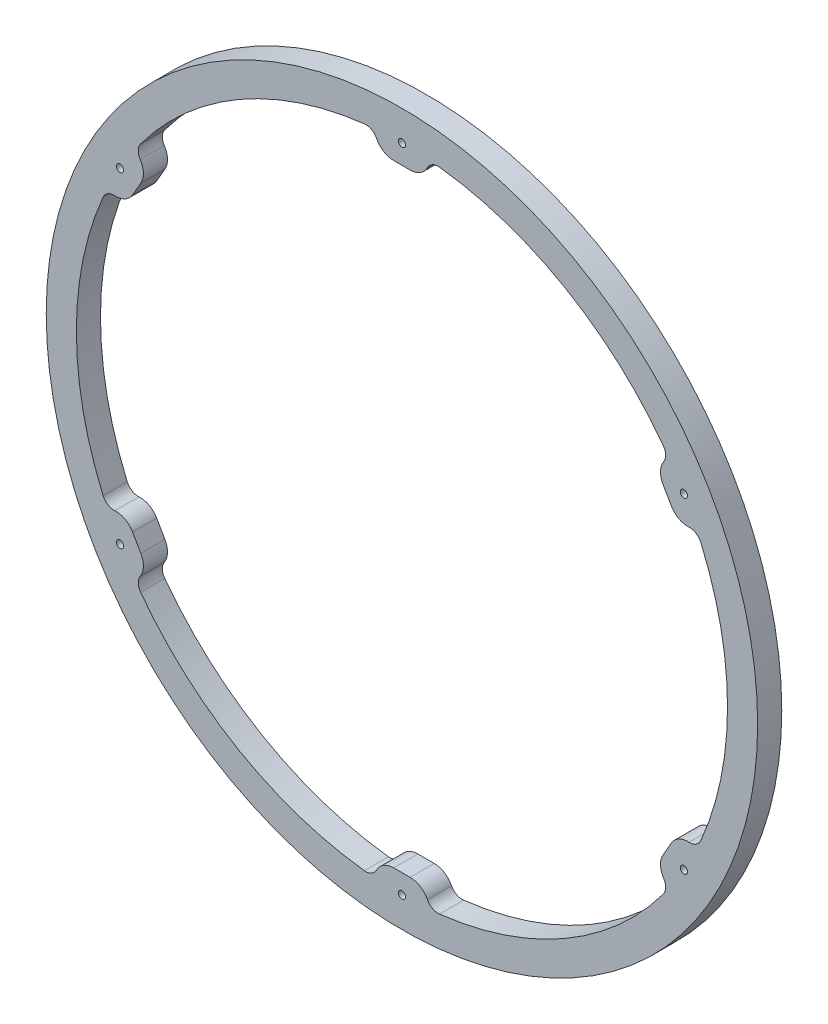
from build123d import *

# Parameters (mm, degrees)
SKETCH1_R           = 147.5
SKETCH1_R_2         = 135
BOSS_EXTRUDE1_DEPTH = 10
BOSS_EXTRUDE2_START = -10
BOSS_EXTRUDE2_DEPTH = 10
FILLET1_R           = 5
FILLET2_R           = 8
CUT_EXTRUDE1_REACH  = 210.836
SKETCH5_R           = 1.5
CIRPATTERN1_DEPTH   = 10
CIRPATTERN1_2_DEPTH = 10


# Read off the part's stored shape, not the designer's step: CirPattern1
with BuildPart() as part:
    # Sketch1 → Boss-Extrude1 (new body)
    with BuildSketch(Plane.XY):
        Circle(SKETCH1_R)
        Circle(SKETCH1_R_2, mode=Mode.SUBTRACT)
    extrude(amount=BOSS_EXTRUDE1_DEPTH)

    # Sketch3 → Boss-Extrude2 (add)
    with BuildSketch(Plane.XY.offset(10).offset(BOSS_EXTRUDE2_START)):
        with BuildLine():
            Line((-10, 127), (10, 127))
            Line((10, 127), (10, 134.629120178))
            ThreePointArc((10, 134.629120178), (0, 135), (-10, 134.629120178))
            Line((-10, 134.629120178), (-10, 127))
        make_face()
    extrude(amount=BOSS_EXTRUDE2_DEPTH)

    # Fillet1
    fillet1_edges = [part.edges().sort_by_distance(p)[0] for p in [
        (-10, 134.629120178, 5),
        (10, 134.629120178, 5),
    ]]
    fillet(fillet1_edges, radius=FILLET1_R)

    # Fillet2
    fillet2_edges = [part.edges().sort_by_distance(p)[0] for p in [
        (10, 127, 5),
        (-10, 127, 5),
    ]]
    fillet(fillet2_edges, radius=FILLET2_R)

    # Sketch5 → Cut-Extrude1 (cut, up to next)
    with BuildSketch(Plane.XY.offset(10), mode=Mode.PRIVATE) as cut_extrude1_sk1:
        with Locations((0, 135)):
            Circle(SKETCH5_R)
    cut_extrude1_tool1 = extrude(cut_extrude1_sk1.sketch, amount=-CUT_EXTRUDE1_REACH, mode=Mode.PRIVATE) & part.part
    add(cut_extrude1_tool1.solids().sort_by_distance((0, 135, 10))[0], mode=Mode.SUBTRACT)

    # CirPattern1 outline → CirPattern1 (cut)
    with BuildSketch(Plane.XY):
        with BuildLine():
            ThreePointArc((-116.156224207, 68.794851392), (-118.212467617, 68.25), (-117.656201059, 66.196815275))
            ThreePointArc((-117.656201059, 66.196815275), (-116.913429511, 67.5), (-116.156224207, 68.794851392))
        make_face()
        with BuildLine():
            ThreePointArc((-116.156224207, -68.794851392), (-116.913429511, -67.5), (-117.656201059, -66.196815275))
            ThreePointArc((-117.656201059, -66.196815275), (-118.212467617, -68.25), (-116.156224207, -68.794851392))
        make_face()
        with BuildLine():
            ThreePointArc((1.499976852, -134.991666667), (0, -135), (-1.499976852, -134.991666667))
            ThreePointArc((-1.499976852, -134.991666667), (0, -136.5), (1.499976852, -134.991666667))
        make_face()
        with BuildLine():
            ThreePointArc((117.656201059, -66.196815275), (116.913429511, -67.5), (116.156224207, -68.794851392))
            ThreePointArc((116.156224207, -68.794851392), (118.212467617, -68.25), (117.656201059, -66.196815275))
        make_face()
        with BuildLine():
            ThreePointArc((116.156224207, 68.794851392), (116.913429511, 67.5), (117.656201059, 66.196815275))
            ThreePointArc((117.656201059, 66.196815275), (118.212467617, 68.25), (116.156224207, 68.794851392))
        make_face()
    extrude(amount=CIRPATTERN1_DEPTH, mode=Mode.SUBTRACT)

    # CirPattern1 2 outline → CirPattern1 2 (add)
    with BuildSketch(Plane.XY):
        with BuildLine():
            ThreePointArc((-119.055197564, 56.567845161), (-114.80628077, 57.519573858), (-111.685156467, 60.555634549))
            Line((-111.685156467, 60.555634549), (-108.285296095, 66.444365451))
            ThreePointArc((-108.285296095, 66.444365451), (-107.216552561, 70.665368732), (-108.516789729, 74.820902963))
            ThreePointArc((-108.516789729, 74.820902963), (-109.329067487, 77.707176829), (-108.344090318, 80.539171173))
            ThreePointArc((-108.344090318, 80.539171173), (-112.403647927, 74.76911082), (-116.156224207, 68.794851392))
            ThreePointArc((-116.156224207, 68.794851392), (-115.614391405, 66.75), (-117.656201059, 66.196815275))
            ThreePointArc((-117.656201059, 66.196815275), (-120.953773352, 59.959859172), (-123.921013395, 53.559148978))
            ThreePointArc((-123.921013395, 53.559148978), (-121.960922934, 55.828161401), (-119.055197564, 56.567845161))
        make_face()
        with BuildLine():
            ThreePointArc((119.055197564, 56.567845161), (121.960922934, 55.828161401), (123.921013394, 53.559148978))
            ThreePointArc((123.921013394, 53.559148978), (120.953773352, 59.959859172), (117.656201059, 66.196815275))
            ThreePointArc((117.656201059, 66.196815275), (115.614391405, 66.75), (116.156224207, 68.794851392))
            ThreePointArc((116.156224207, 68.794851392), (112.403647927, 74.76911082), (108.344090318, 80.539171173))
            ThreePointArc((108.344090318, 80.539171173), (109.329067487, 77.707176829), (108.516789729, 74.820902963))
            ThreePointArc((108.516789729, 74.820902963), (107.216552561, 70.665368732), (108.285296095, 66.444365451))
            Line((108.285296095, 66.444365451), (111.685156467, 60.555634549))
            ThreePointArc((111.685156467, 60.555634549), (114.80628077, 57.519573858), (119.055197564, 56.567845161))
        make_face()
        with BuildLine():
            ThreePointArc((108.516789729, -74.820902963), (109.329067487, -77.707176829), (108.344090318, -80.539171173))
            ThreePointArc((108.344090318, -80.539171173), (112.403647927, -74.76911082), (116.156224207, -68.794851392))
            ThreePointArc((116.156224207, -68.794851392), (115.614391405, -66.75), (117.656201059, -66.196815275))
            ThreePointArc((117.656201059, -66.196815275), (120.953773352, -59.959859172), (123.921013395, -53.559148978))
            ThreePointArc((123.921013395, -53.559148978), (121.960922934, -55.828161401), (119.055197564, -56.567845161))
            ThreePointArc((119.055197564, -56.567845161), (114.80628077, -57.519573858), (111.685156467, -60.555634549))
            Line((111.685156467, -60.555634549), (108.285296095, -66.444365451))
            ThreePointArc((108.285296095, -66.444365451), (107.216552561, -70.665368732), (108.516789729, -74.820902963))
        make_face()
        with BuildLine():
            ThreePointArc((-10.538407835, -131.388748124), (-12.631855447, -133.53533823), (-15.576923077, -134.098320152))
            ThreePointArc((-15.576923077, -134.098320152), (-8.550125426, -134.728969992), (-1.499976852, -134.991666667))
            ThreePointArc((-1.499976852, -134.991666667), (0, -133.5), (1.499976852, -134.991666667))
            ThreePointArc((1.499976852, -134.991666667), (8.550125426, -134.728969992), (15.576923077, -134.098320152))
            ThreePointArc((15.576923077, -134.098320152), (12.631855447, -133.53533823), (10.538407835, -131.388748124))
            ThreePointArc((10.538407835, -131.388748124), (7.589728209, -128.18494259), (3.399860372, -127))
            Line((3.399860372, -127), (-3.399860372, -127))
            ThreePointArc((-3.399860372, -127), (-7.589728209, -128.18494259), (-10.538407835, -131.388748124))
        make_face()
        with BuildLine():
            ThreePointArc((-119.055197564, -56.567845161), (-121.960922934, -55.828161401), (-123.921013394, -53.559148978))
            ThreePointArc((-123.921013394, -53.559148978), (-120.953773352, -59.959859172), (-117.656201059, -66.196815275))
            ThreePointArc((-117.656201059, -66.196815275), (-115.614391405, -66.75), (-116.156224207, -68.794851392))
            ThreePointArc((-116.156224207, -68.794851392), (-112.403647927, -74.76911082), (-108.344090318, -80.539171173))
            ThreePointArc((-108.344090318, -80.539171173), (-109.329067487, -77.707176829), (-108.516789729, -74.820902963))
            ThreePointArc((-108.516789729, -74.820902963), (-107.216552561, -70.665368732), (-108.285296095, -66.444365451))
            Line((-108.285296095, -66.444365451), (-111.685156467, -60.555634549))
            ThreePointArc((-111.685156467, -60.555634549), (-114.80628077, -57.519573858), (-119.055197564, -56.567845161))
        make_face()
    extrude(amount=CIRPATTERN1_2_DEPTH)


solid = part.part
